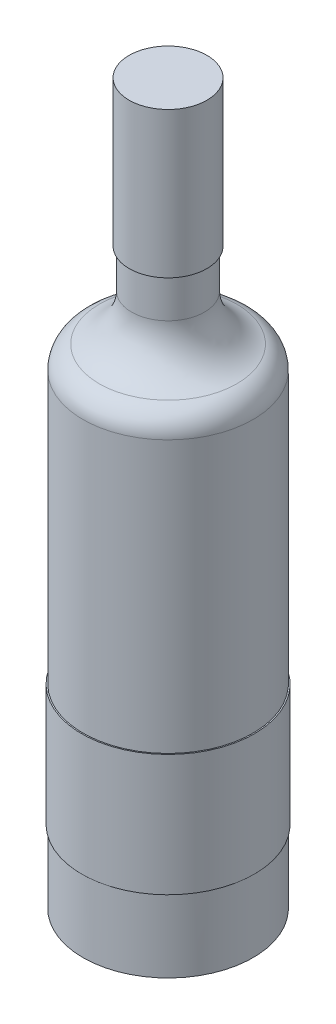
from build123d import *

# Parameters (mm, degrees)
SKETCH2_R           = 35
BOSS_EXTRUDE1_DEPTH = 200
SKETCH3_R           = 15
BOSS_EXTRUDE2_DEPTH = 95
FILLET1_R           = 20
FILLET2_R           = 10
BOSS_EXTRUDE3_START = 1
SKETCH4_R           = 16
BOSS_EXTRUDE3_DEPTH = 60
BOSS_EXTRUDE4_START = -30
SKETCH5_R           = 35.5
BOSS_EXTRUDE4_DEPTH = 50


with BuildPart() as part:
    # Sketch2 → Boss-Extrude1 (new body)
    with BuildSketch(Plane(origin=(0, 0, 0), x_dir=(1, 0, 0), z_dir=(0, 1, 0))):
        with Locations(Location((0, 0, 0), (0, 0, 270))):
            Circle(SKETCH2_R)
    extrude(amount=BOSS_EXTRUDE1_DEPTH)

    # Sketch3 → Boss-Extrude2 (add)
    with BuildSketch(Plane(origin=(0, 200, 0), x_dir=(1, 0, 0), z_dir=(0, 1, 0))):
        with Locations(Location((0, 0, 0), (0, 0, 270))):
            Circle(SKETCH3_R)
    extrude(amount=BOSS_EXTRUDE2_DEPTH)

    # Fillet1
    fillet1_edges = [part.edges().sort_by_distance(p)[0] for p in [
        (0, 200, -15),
    ]]
    fillet(fillet1_edges, radius=FILLET1_R - 0.0001)  # a hair under: the kernel refuses the full size

    # Fillet2
    fillet2_edges = [part.edges().sort_by_distance(p)[0] for p in [
        (0, 200, -35),
    ]]
    fillet(fillet2_edges, radius=FILLET2_R)

    # Sketch4 → Boss-Extrude3 (add)
    with BuildSketch(Plane(origin=(0, 295, 0), x_dir=(1, 0, 0), z_dir=(0, 1, 0)).offset(BOSS_EXTRUDE3_START)):
        with Locations(Location((0, 0, 0), (0, 0, 270))):
            Circle(SKETCH4_R)
    extrude(amount=-BOSS_EXTRUDE3_DEPTH)

    # Sketch5 → Boss-Extrude4 (add)
    with BuildSketch(Plane.XZ.offset(BOSS_EXTRUDE4_START)):
        with Locations(Location((0, 0, 0), (0, 0, 270))):
            Circle(SKETCH5_R)
    extrude(amount=-BOSS_EXTRUDE4_DEPTH)


solid = part.part
